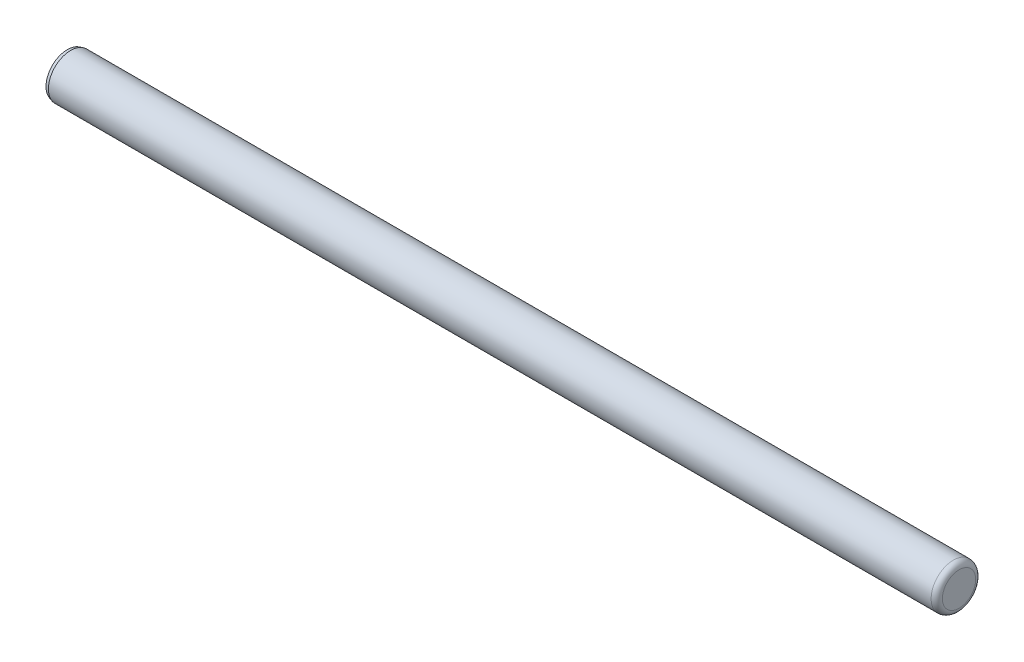
from build123d import *


with BuildPart() as part:
    # Sketch3 → Revolve1 (revolve)
    with BuildSketch(Plane.XY):
        with BuildLine():
            Line((127, 4.7498), (127, 0))
            Line((127, 0), (-127, 0))
            Line((-127, 0), (-127, 6.07695))
            Line((-127, 6.07695), (-126.047761486, 6.35))
            Line((-126.047761486, 6.35), (125.3998, 6.35))
            ThreePointArc((125.3998, 6.35), (126.531312271, 5.881312271), (127, 4.7498))
        make_face()
    revolve(axis=Axis((-127, 0, 0), (1, 0, 0)))


solid = part.part
